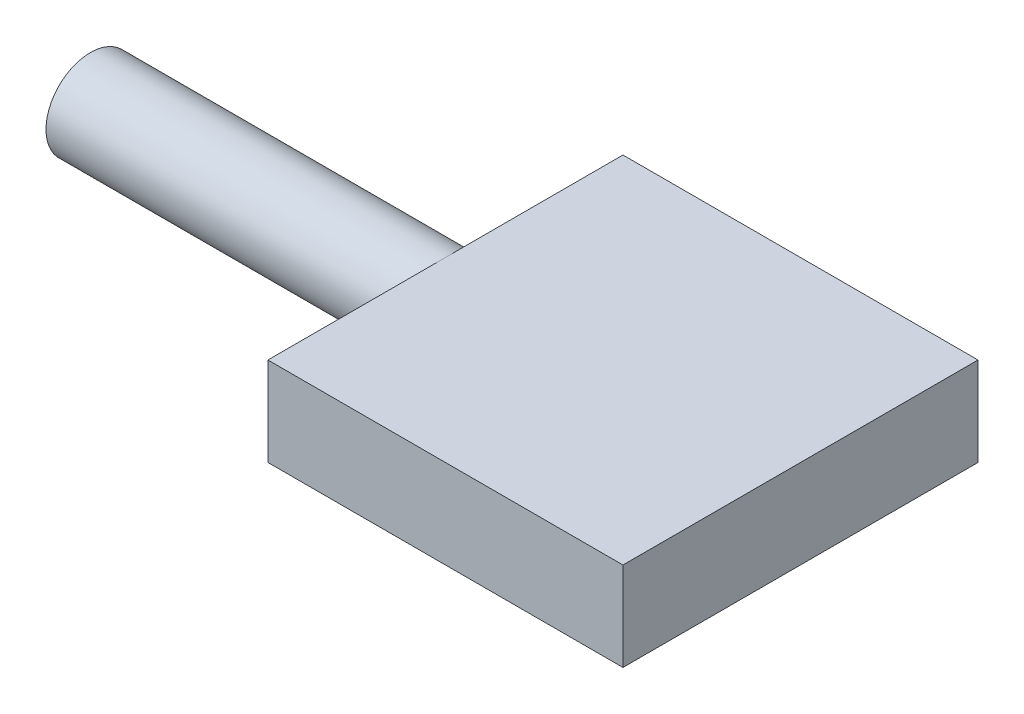
from build123d import *

# Parameters (mm, degrees)
CROQUIS1_W              = 40
CROQUIS1_H              = 40
SALIENTE_EXTRUIR1_DEPTH = 10
CROQUIS2_R              = 5
SALIENTE_EXTRUIR2_DEPTH = 40


with BuildPart() as part:
    # Croquis1 → Saliente-Extruir1 (new body)
    with BuildSketch(Plane(origin=(0, 0, 0), x_dir=(1, 0, 0), z_dir=(0, 1, 0))):
        with Locations((20, 20)):
            Rectangle(CROQUIS1_W, CROQUIS1_H)
    extrude(amount=SALIENTE_EXTRUIR1_DEPTH)

    # Croquis2 → Saliente-Extruir2 (add)
    with BuildSketch(Plane.ZY):
        with Locations((-20, 5)):
            Circle(CROQUIS2_R)
    extrude(amount=SALIENTE_EXTRUIR2_DEPTH)


solid = part.part
